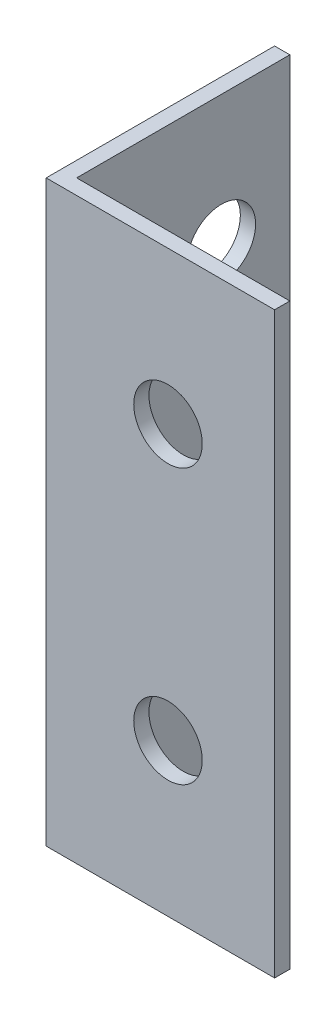
from build123d import *

# Parameters (mm, degrees)
EXTRUDE_1_DEPTH     = 38
SKETCH_2_R          = 2.25
CUT_EXTRUDE_1_DEPTH = 44.185645763
SKETCH_3_R          = 2.25
CUT_EXTRUDE_2_DEPTH = 44.185645763
SKETCH_4_R          = 2.25
CUT_EXTRUDE_3_DEPTH = 44.185645763


with BuildPart() as part:
    # Эскиз1 → Бобышка-Вытянуть1 (new body)
    with BuildSketch(Plane(origin=(0, 0, 0), x_dir=(1, 0, 0), z_dir=(0, 1, 0))):
        Polygon((0, 0), (0, 15), (1, 15), (1, 1), (15, 1), (15, 0), align=None)
    extrude(amount=EXTRUDE_1_DEPTH)

    # Эскиз2 → Вырез-Вытянуть1 (cut, through all)
    with BuildSketch(Plane(origin=(1, 0, 0), x_dir=(0, 0, -1), z_dir=(1, 0, 0))):
        with Locations((10.5, 29.5)):
            Circle(SKETCH_2_R)
    extrude(amount=-CUT_EXTRUDE_1_DEPTH, mode=Mode.SUBTRACT)

    # Эскиз3 → Вырез-Вытянуть2 (cut, through all)
    with BuildSketch(Plane(origin=(0, 0, -1), x_dir=(-1, 0, 0), z_dir=(0, 0, -1))):
        with Locations((-8, 10)):
            Circle(SKETCH_3_R)
    extrude(amount=-CUT_EXTRUDE_2_DEPTH, mode=Mode.SUBTRACT)

    # Эскиз4 → Вырез-Вытянуть3 (cut, through all)
    with BuildSketch(Plane(origin=(0, 0, -1), x_dir=(-1, 0, 0), z_dir=(0, 0, -1))):
        with Locations((-8, 28)):
            Circle(SKETCH_4_R)
    extrude(amount=-CUT_EXTRUDE_3_DEPTH, mode=Mode.SUBTRACT)


solid = part.part
